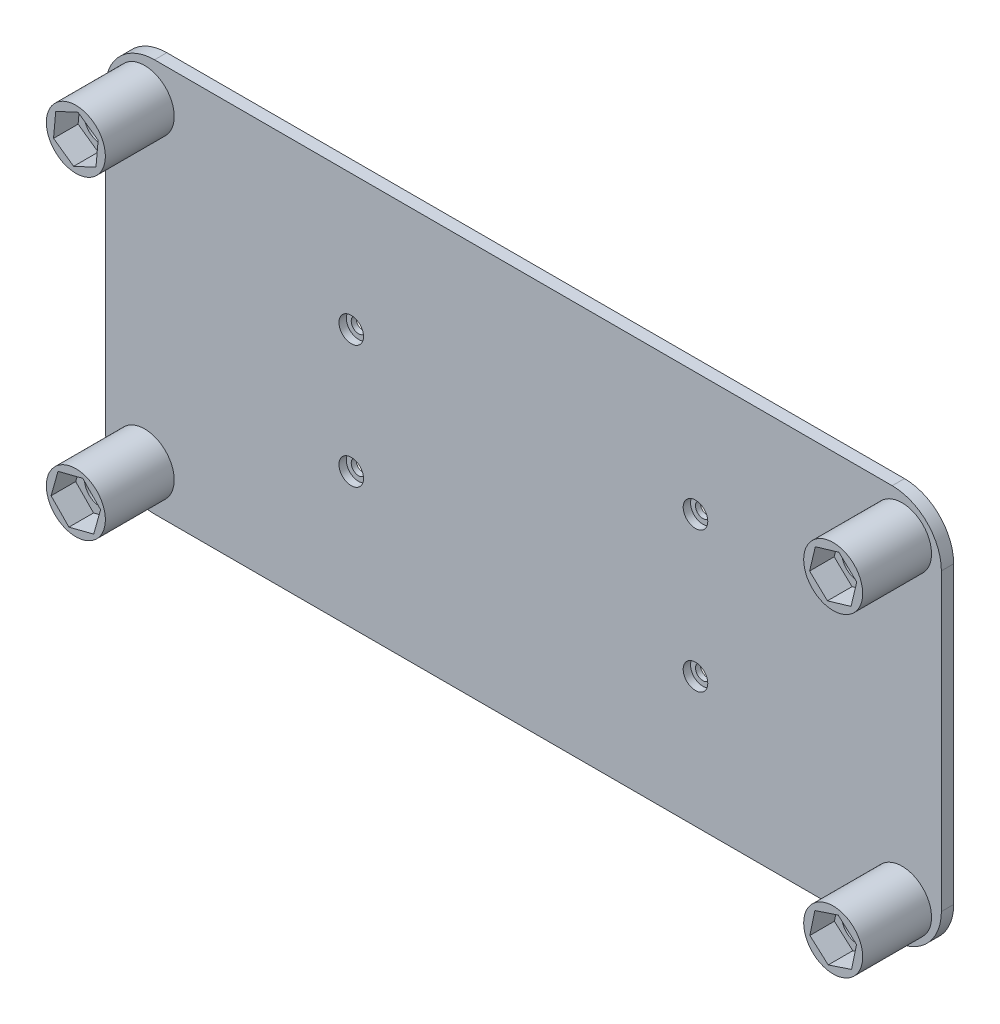
from build123d import *

# Parameters (mm, degrees)
EXTRUDE_1_DEPTH          = 2.5
CUT_EXTRUDE_1_DEPTH      = 42
CUT_EXTRUDE_1_DEPTH_BACK = 10
SKETCH_2_R               = 1.5
SKETCH_3_R               = 2.5
CUT_EXTRUDE_2_DEPTH      = 1.5
SKETCH_7_R               = 6
EXTRUDE_4_DEPTH          = 14
BUTTON_LEFT_NUT_DEPTH    = 5
UP_LEFT_NUT_DEPTH        = 5
UP_RIGHT_NUT_DEPTH       = 5
BUTTON_RIGHT_NUT_DEPTH   = 5
SKETCH_13_R              = 3.25
CUT_EXTRUDE_7_DEPTH      = 13
SKETCH_15_R              = 3.25
CUT_EXTRUDE_8_DEPTH      = 13
SKETCH_16_R              = 3.25
CUT_EXTRUDE_9_DEPTH      = 13
SKETCH_17_R              = 3.25
CUT_EXTRUDE_10_DEPTH     = 13


with BuildPart() as part:
    # 草图1 → 凸台-拉伸1 (new body)
    with BuildSketch(Plane.XY):
        with BuildLine():
            Line((-72.574116531, 35.487390308), (77.425883469, 35.487390308))
            ThreePointArc((77.425883469, 35.487390308), (84.496951281, 32.558458119), (87.425883469, 25.487390308))
            Line((87.425883469, 25.487390308), (87.425883469, -34.512609692))
            ThreePointArc((87.425883469, -34.512609692), (84.496951281, -41.583677504), (77.425883469, -44.512609692))
            Line((77.425883469, -44.512609692), (-72.574116531, -44.512609692))
            ThreePointArc((-72.574116531, -44.512609692), (-79.645184343, -41.583677504), (-82.574116531, -34.512609692))
            Line((-82.574116531, -34.512609692), (-82.574116531, 25.487390308))
            ThreePointArc((-82.574116531, 25.487390308), (-79.645184343, 32.558458119), (-72.574116531, 35.487390308))
        make_face()
    extrude(amount=EXTRUDE_1_DEPTH)

    # 草图2 → 切除-拉伸1 (cut, two sides: drawn at the far end of the back side and taken through both)
    with BuildSketch(Plane.XY.offset(2.5).offset(-CUT_EXTRUDE_1_DEPTH_BACK)):
        with Locations((-32.574116531, 7.987390308)):
            Circle(SKETCH_2_R)
        with Locations((-32.574116531, -17.012609692)):
            Circle(SKETCH_2_R)
        with Locations((37.425883469, 10.450230815)):
            Circle(SKETCH_2_R)
        with Locations((37.425883469, -18.090102414)):
            Circle(SKETCH_2_R)
    extrude(amount=CUT_EXTRUDE_1_DEPTH + CUT_EXTRUDE_1_DEPTH_BACK, mode=Mode.SUBTRACT)

    # 草图3 → 切除-拉伸2 (cut)
    with BuildSketch(Plane.XY.offset(2.5)):
        with Locations((-32.574116531, 7.987390308)):
            Circle(SKETCH_3_R)
        with Locations((37.425883469, 10.450230815)):
            Circle(SKETCH_3_R)
        with Locations((37.425883469, -18.090102414)):
            Circle(SKETCH_3_R)
        with Locations((-32.574116531, -17.012609692)):
            Circle(SKETCH_3_R)
    extrude(amount=-CUT_EXTRUDE_2_DEPTH, mode=Mode.SUBTRACT)

    # 草图7 → 凸台-拉伸4 (add)
    with BuildSketch(Plane.XY.offset(2.5)):
        with Locations((-74.574116531, 27.487390308)):
            Circle(SKETCH_7_R)
        with Locations((-74.574116531, -36.512609692)):
            Circle(SKETCH_7_R)
        with Locations((79.425883469, 27.487390308)):
            Circle(SKETCH_7_R)
        with Locations((79.425883469, -36.512609692)):
            Circle(SKETCH_7_R)
    extrude(amount=EXTRUDE_4_DEPTH)

    # 草图9 → button left nut (cut)
    with BuildSketch(Plane.XY.offset(16.5)):
        Polygon((-70.944636645, -40.226166125), (-69.543342379, -35.226166125), (-73.172822265, -31.512609692), (-78.203596417, -32.79905326), (-79.604890683, -37.79905326), (-75.975410797, -41.512609692), align=None)
    extrude(amount=-BUTTON_LEFT_NUT_DEPTH, mode=Mode.SUBTRACT)

    # 草图10 → up left nut (cut)
    with BuildSketch(Plane.XY.offset(16.5)):
        Polygon((-70.484611493, 24.610595469), (-70.0379866, 29.59060814), (-74.127491638, 32.467402979), (-78.663621569, 30.364185146), (-79.110246462, 25.384172475), (-75.020741423, 22.507377636), align=None)
    extrude(amount=-UP_LEFT_NUT_DEPTH, mode=Mode.SUBTRACT)

    # 草图11 → up right nut (cut)
    with BuildSketch(Plane.XY.offset(16.5)):
        Polygon((83.054173559, 24.047112554), (84.219396445, 28.909442821), (80.591106355, 32.349720575), (75.797593379, 30.927668061), (74.632370493, 26.065337794), (78.260660583, 22.62506004), align=None)
    extrude(amount=-UP_RIGHT_NUT_DEPTH, mode=Mode.SUBTRACT)

    # 草图12 → button right nut (cut)
    with BuildSketch(Plane.XY.offset(16.5)):
        Polygon((83.162930062, -39.834428887), (84.171186575, -34.937142005), (80.434139981, -31.61532281), (75.688836876, -33.190790498), (74.680580363, -38.08807738), (78.417626957, -41.409896575), align=None)
    extrude(amount=-BUTTON_RIGHT_NUT_DEPTH, mode=Mode.SUBTRACT)

    # 草图13 → 切除-拉伸7 (cut)
    with BuildSketch(Plane.XY.offset(16.5)):
        with Locations((-74.574116531, -36.512609692)):
            Circle(SKETCH_13_R)
    extrude(amount=-CUT_EXTRUDE_7_DEPTH, mode=Mode.SUBTRACT)

    # 草图15 → 切除-拉伸8 (cut)
    with BuildSketch(Plane.XY.offset(16.5)):
        with Locations((-74.574116531, 27.487390308)):
            Circle(SKETCH_15_R)
    extrude(amount=-CUT_EXTRUDE_8_DEPTH, mode=Mode.SUBTRACT)

    # 草图16 → 切除-拉伸9 (cut)
    with BuildSketch(Plane.XY.offset(16.5)):
        with Locations((79.425883469, 27.487390308)):
            Circle(SKETCH_16_R)
    extrude(amount=-CUT_EXTRUDE_9_DEPTH, mode=Mode.SUBTRACT)

    # 草图17 → 切除-拉伸10 (cut)
    with BuildSketch(Plane.XY.offset(16.5)):
        with Locations((79.425883469, -36.512609692)):
            Circle(SKETCH_17_R)
    extrude(amount=-CUT_EXTRUDE_10_DEPTH, mode=Mode.SUBTRACT)


solid = part.part
